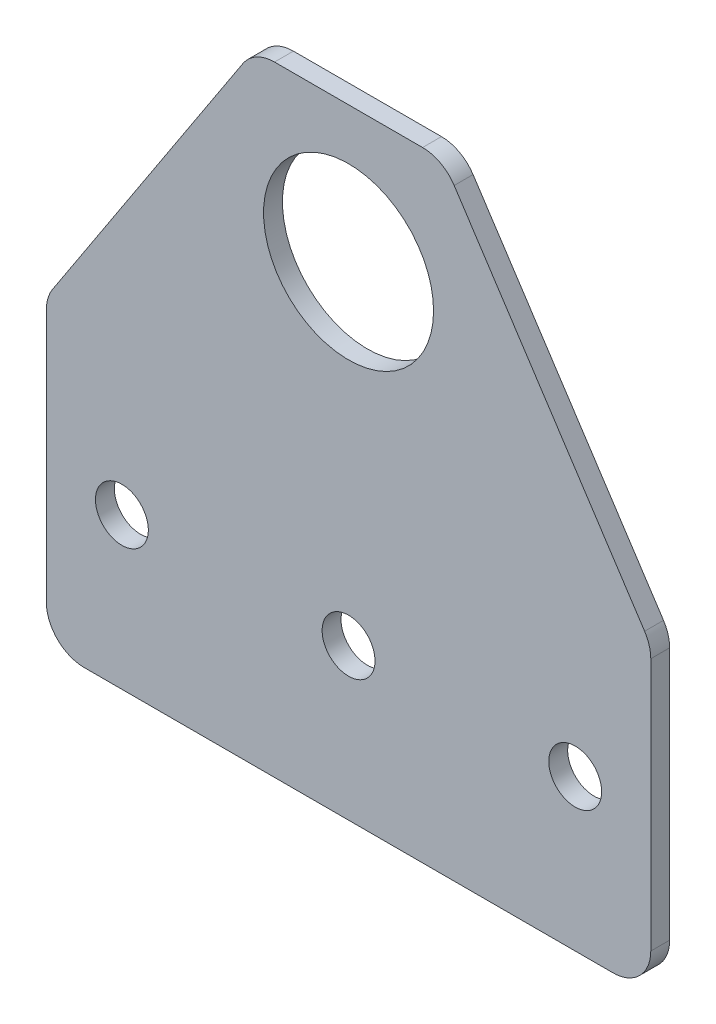
from build123d import *

# Parameters (mm, degrees)
ESQUISSE1_R        = 11.25
ESQUISSE1_R_2      = 3.5
BOSS_EXTRU_1_DEPTH = 2.5
CONG_1_R           = 5


with BuildPart() as part:
    # Esquisse1 → Boss.-Extru.1 (new body)
    with BuildSketch(Plane.XY):
        Polygon((-40, 0), (40, 0), (40, 40), (12.5, 82), (-12.5, 82), (-40, 40), align=None)
        with Locations((0, 64)):
            Circle(ESQUISSE1_R, mode=Mode.SUBTRACT)
        with Locations((0, 20)):
            Circle(ESQUISSE1_R_2, mode=Mode.SUBTRACT)
        with Locations((30, 20)):
            Circle(ESQUISSE1_R_2, mode=Mode.SUBTRACT)
        with Locations((-30, 20)):
            Circle(ESQUISSE1_R_2, mode=Mode.SUBTRACT)
    extrude(amount=BOSS_EXTRU_1_DEPTH)

    # Congé1
    cong_1_edges = [part.edges().sort_by_distance(p)[0] for p in [
        (12.5, 82, 1.25),
        (-12.5, 82, 1.25),
        (-40, 40, 1.25),
        (40, 40, 1.25),
        (40, 0, 1.25),
        (-40, 0, 1.25),
    ]]
    fillet(cong_1_edges, radius=CONG_1_R)


solid = part.part
